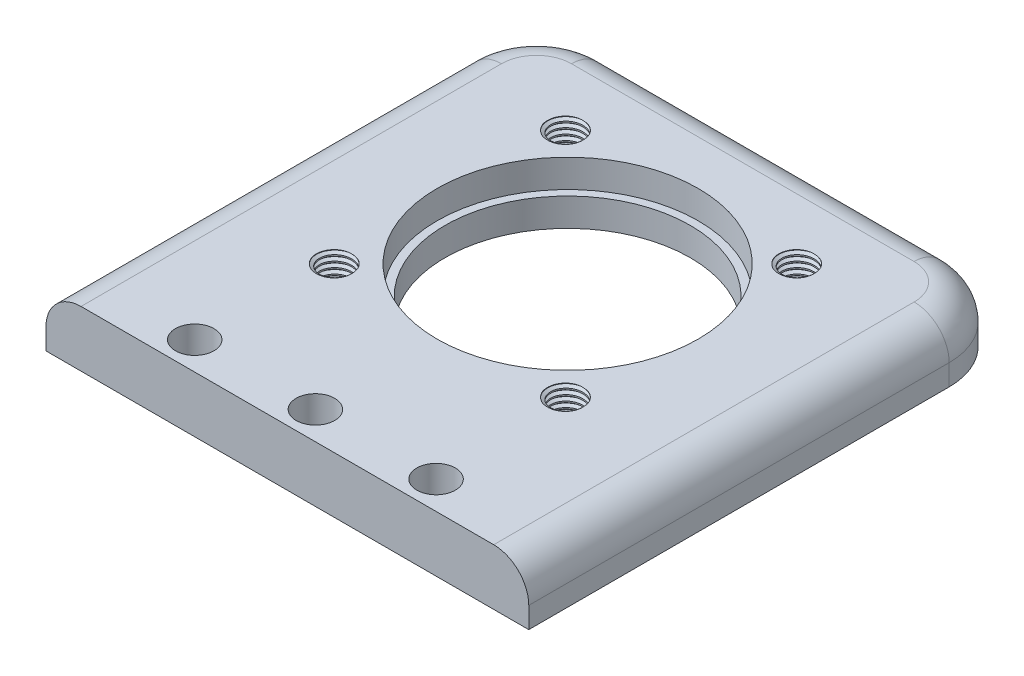
from build123d import *

# Parameters (mm, degrees)
SKETCH1_W           = 68.9
SKETCH1_H           = 70
SKETCH1_R           = 18.63
SKETCH1_R_2         = 2.75
BOSS_EXTRUDE1_DEPTH = 8
FILLET1_R           = 10
FILLET2_R           = 5
SKETCH2_R           = 18.63
SKETCH2_R_2         = 17.5
BOSS_EXTRUDE2_DEPTH = 4
SKETCH5_R           = 2.3
CUT_EXTRUDE1_DEPTH  = 6
THREAD1_PITCH       = 0.8
THREAD2_PITCH       = 0.8
THREAD3_PITCH       = 0.8
CUT_EXTRUDE2_DEPTH  = 6
THREAD4_PITCH       = 0.8


with BuildPart() as part:
    # Sketch1 → Boss-Extrude1 (new body)
    with BuildSketch(Plane(origin=(0, 0, 0), x_dir=(1, 0, 0), z_dir=(0, 1, 0))):
        with Locations((34.45, 35)):
            Rectangle(SKETCH1_W, SKETCH1_H)
        with Locations(Location((34.45, 40, 0), (0, 0, 270))):
            Circle(SKETCH1_R, mode=Mode.SUBTRACT)
        with Locations(Location((34.45, 4, 0), (0, 0, 270))):
            Circle(SKETCH1_R_2, mode=Mode.SUBTRACT)
        with Locations(Location((17.225, 4, 0), (0, 0, 270))):
            Circle(SKETCH1_R_2, mode=Mode.SUBTRACT)
        with Locations(Location((51.675, 4, 0), (0, 0, 270))):
            Circle(SKETCH1_R_2, mode=Mode.SUBTRACT)
    extrude(amount=BOSS_EXTRUDE1_DEPTH)

    # Fillet1
    fillet1_edges = [part.edges().sort_by_distance(p)[0] for p in [
        (0, 4, -70),
        (68.9, 4, -70),
    ]]
    fillet(fillet1_edges, radius=FILLET1_R)

    # Fillet2
    fillet2_edges = [part.edges().sort_by_distance(p)[0] for p in [
        (68.9, 8, -30),
        (34.45, 8, -70),
        (0, 8, -30),
        (2.928932188, 8, -67.071067812),
        (65.971067812, 8, -67.071067812),
    ]]
    fillet(fillet2_edges, radius=FILLET2_R)

    # Sketch2 → Boss-Extrude2 (add)
    with BuildSketch(Plane.XZ):
        with Locations(Location((34.45, -40, 0), (0, 0, 270))):
            Circle(SKETCH2_R)
        with Locations(Location((34.45, -40, 0), (0, 0, 270))):
            Circle(SKETCH2_R_2, mode=Mode.SUBTRACT)
    extrude(amount=-BOSS_EXTRUDE2_DEPTH)

    # Sketch5 → Cut-Extrude1 (cut)
    with BuildSketch(Plane(origin=(0, 8, 0), x_dir=(1, 0, 0), z_dir=(0, 1, 0))):
        with Locations(Location((17.95, 23.5, 0), (0, 0, 270))):
            Circle(SKETCH5_R)
        with Locations(Location((50.95, 23.5, 0), (0, 0, 270))):
            Circle(SKETCH5_R)
        with Locations(Location((17.95, 56.5, 0), (0, 0, 270))):
            Circle(SKETCH5_R)
        with BuildLine():
            Line((50.95, 56.5), (50.95, 54.2))
            ThreePointArc((50.95, 54.2), (52.576345597, 58.126345597), (48.65, 56.5))
            Line((48.65, 56.5), (50.95, 56.5))
        make_face()
    extrude(amount=-CUT_EXTRUDE1_DEPTH, mode=Mode.SUBTRACT)

    # Thread1: the profile of Thread Profile1 profile screwed along a right-hand helix of 8.75 turns, 8 arcs to a turn; built about Z, then put on its axis
    thread1_z = Axis((0, 0, 0), (0, 0, 1))
    thread1_corners = [(2.2997, 0, -0.000173205), (2.7330127, 0, 0.249999999), (2.7330127, 0, 0.349999999), (2.2997, 0, 0.600173203)]
    with BuildLine(mode=Mode.PRIVATE) as thread1_profile:
        Line(thread1_corners[0], thread1_corners[1])
        Line(thread1_corners[1], thread1_corners[2])
        Line(thread1_corners[2], thread1_corners[3])
        Line(thread1_corners[3], thread1_corners[0])
    thread1_cap = Face(thread1_profile.wire())
    thread1_turn_angles = [0, 22.5, 45, 67.5, 90, 112.5, 135, 157.5, 180, 202.5, 225, 247.5, 270, 292.5, 315, 337.5, 360]
    thread1_turn_weights = [1, 0.9238795325112867, 1, 0.9238795325112867, 1, 0.9238795325112867, 1, 0.9238795325112867, 1, 0.9238795325112867, 1, 0.9238795325112867, 1, 0.9238795325112867, 1, 0.9238795325112867, 1]
    thread1_turn_rails = [Edge.make_bspline([Vector(p[0], p[1], 0).rotate(thread1_z, thread1_turn_angles[k]) / thread1_turn_weights[k] + Vector(0, 0, p[2] + THREAD1_PITCH * thread1_turn_angles[k] / 360) for k in range(17)], [0, 0, 0, 1, 1, 2, 2, 3, 3, 4, 4, 5, 5, 6, 6, 7, 7, 8, 8, 8], 2, thread1_turn_weights) for p in thread1_corners]
    thread1_turn_sides = [Face.make_surface_from_curves(thread1_turn_rails[p[0]], thread1_turn_rails[p[1]]) for p in [(0, 1), (1, 2), (2, 3), (3, 0)]]
    thread1_last_angles = [2880, 2902.5, 2925, 2947.5, 2970, 2992.5, 3015, 3037.5, 3060, 3082.5, 3105, 3127.5, 3150]
    thread1_last_weights = [1, 0.9238795325112867, 1, 0.9238795325112867, 1, 0.9238795325112867, 1, 0.9238795325112867, 1, 0.9238795325112867, 1, 0.9238795325112898, 1]
    thread1_last_rails = [Edge.make_bspline([Vector(p[0], p[1], 0).rotate(thread1_z, thread1_last_angles[k]) / thread1_last_weights[k] + Vector(0, 0, p[2] + THREAD1_PITCH * thread1_last_angles[k] / 360) for k in range(13)], [0, 0, 0, 1, 1, 2, 2, 3, 3, 4, 4, 5, 5, 6, 6, 6], 2, thread1_last_weights) for p in thread1_corners]
    thread1_last_sides = [Face.make_surface_from_curves(thread1_last_rails[p[0]], thread1_last_rails[p[1]]) for p in [(0, 1), (1, 2), (2, 3), (3, 0)]]
    thread1 = Plane(origin=(17.95, 9, -56.5), x_dir=(-1, 0, 0), z_dir=(0, -1, 0)) * Solid(Shell([*[p.moved(Location((0, 0, THREAD1_PITCH * i))) for i in range(8) for p in thread1_turn_sides], *thread1_last_sides, thread1_cap, thread1_cap.rotate(thread1_z, 3150).moved(Location((0, 0, THREAD1_PITCH * 3150 / 360)))]))
    add(thread1, mode=Mode.SUBTRACT)

    # Thread2: the profile of Thread Profile2 profile screwed along a right-hand helix of 8.75 turns, 8 arcs to a turn; built about Z, then put on its axis
    thread2_z = Axis((0, 0, 0), (0, 0, 1))
    thread2_corners = [(2.2997, 0, -0.000173205), (2.7330127, 0, 0.249999999), (2.7330127, 0, 0.349999999), (2.2997, 0, 0.600173203)]
    with BuildLine(mode=Mode.PRIVATE) as thread2_profile:
        Line(thread2_corners[0], thread2_corners[1])
        Line(thread2_corners[1], thread2_corners[2])
        Line(thread2_corners[2], thread2_corners[3])
        Line(thread2_corners[3], thread2_corners[0])
    thread2_cap = Face(thread2_profile.wire())
    thread2_turn_angles = [0, 22.5, 45, 67.5, 90, 112.5, 135, 157.5, 180, 202.5, 225, 247.5, 270, 292.5, 315, 337.5, 360]
    thread2_turn_weights = [1, 0.9238795325112867, 1, 0.9238795325112867, 1, 0.9238795325112867, 1, 0.9238795325112867, 1, 0.9238795325112867, 1, 0.9238795325112867, 1, 0.9238795325112867, 1, 0.9238795325112867, 1]
    thread2_turn_rails = [Edge.make_bspline([Vector(p[0], p[1], 0).rotate(thread2_z, thread2_turn_angles[k]) / thread2_turn_weights[k] + Vector(0, 0, p[2] + THREAD2_PITCH * thread2_turn_angles[k] / 360) for k in range(17)], [0, 0, 0, 1, 1, 2, 2, 3, 3, 4, 4, 5, 5, 6, 6, 7, 7, 8, 8, 8], 2, thread2_turn_weights) for p in thread2_corners]
    thread2_turn_sides = [Face.make_surface_from_curves(thread2_turn_rails[p[0]], thread2_turn_rails[p[1]]) for p in [(0, 1), (1, 2), (2, 3), (3, 0)]]
    thread2_last_angles = [2880, 2902.5, 2925, 2947.5, 2970, 2992.5, 3015, 3037.5, 3060, 3082.5, 3105, 3127.5, 3150]
    thread2_last_weights = [1, 0.9238795325112867, 1, 0.9238795325112867, 1, 0.9238795325112867, 1, 0.9238795325112867, 1, 0.9238795325112867, 1, 0.9238795325112898, 1]
    thread2_last_rails = [Edge.make_bspline([Vector(p[0], p[1], 0).rotate(thread2_z, thread2_last_angles[k]) / thread2_last_weights[k] + Vector(0, 0, p[2] + THREAD2_PITCH * thread2_last_angles[k] / 360) for k in range(13)], [0, 0, 0, 1, 1, 2, 2, 3, 3, 4, 4, 5, 5, 6, 6, 6], 2, thread2_last_weights) for p in thread2_corners]
    thread2_last_sides = [Face.make_surface_from_curves(thread2_last_rails[p[0]], thread2_last_rails[p[1]]) for p in [(0, 1), (1, 2), (2, 3), (3, 0)]]
    thread2 = Plane(origin=(50.95, 9, -23.5), x_dir=(-1, 0, 0), z_dir=(0, -1, 0)) * Solid(Shell([*[p.moved(Location((0, 0, THREAD2_PITCH * i))) for i in range(8) for p in thread2_turn_sides], *thread2_last_sides, thread2_cap, thread2_cap.rotate(thread2_z, 3150).moved(Location((0, 0, THREAD2_PITCH * 3150 / 360)))]))
    add(thread2, mode=Mode.SUBTRACT)

    # Thread3: the profile of Thread Profile3 profile screwed along a right-hand helix of 8.75 turns, 8 arcs to a turn; built about Z, then put on its axis
    thread3_z = Axis((0, 0, 0), (0, 0, 1))
    thread3_corners = [(2.2997, 0, -0.000173205), (2.7330127, 0, 0.249999999), (2.7330127, 0, 0.349999999), (2.2997, 0, 0.600173203)]
    with BuildLine(mode=Mode.PRIVATE) as thread3_profile:
        Line(thread3_corners[0], thread3_corners[1])
        Line(thread3_corners[1], thread3_corners[2])
        Line(thread3_corners[2], thread3_corners[3])
        Line(thread3_corners[3], thread3_corners[0])
    thread3_cap = Face(thread3_profile.wire())
    thread3_turn_angles = [0, 22.5, 45, 67.5, 90, 112.5, 135, 157.5, 180, 202.5, 225, 247.5, 270, 292.5, 315, 337.5, 360]
    thread3_turn_weights = [1, 0.9238795325112867, 1, 0.9238795325112867, 1, 0.9238795325112867, 1, 0.9238795325112867, 1, 0.9238795325112867, 1, 0.9238795325112867, 1, 0.9238795325112867, 1, 0.9238795325112867, 1]
    thread3_turn_rails = [Edge.make_bspline([Vector(p[0], p[1], 0).rotate(thread3_z, thread3_turn_angles[k]) / thread3_turn_weights[k] + Vector(0, 0, p[2] + THREAD3_PITCH * thread3_turn_angles[k] / 360) for k in range(17)], [0, 0, 0, 1, 1, 2, 2, 3, 3, 4, 4, 5, 5, 6, 6, 7, 7, 8, 8, 8], 2, thread3_turn_weights) for p in thread3_corners]
    thread3_turn_sides = [Face.make_surface_from_curves(thread3_turn_rails[p[0]], thread3_turn_rails[p[1]]) for p in [(0, 1), (1, 2), (2, 3), (3, 0)]]
    thread3_last_angles = [2880, 2902.5, 2925, 2947.5, 2970, 2992.5, 3015, 3037.5, 3060, 3082.5, 3105, 3127.5, 3150]
    thread3_last_weights = [1, 0.9238795325112867, 1, 0.9238795325112867, 1, 0.9238795325112867, 1, 0.9238795325112867, 1, 0.9238795325112867, 1, 0.9238795325112898, 1]
    thread3_last_rails = [Edge.make_bspline([Vector(p[0], p[1], 0).rotate(thread3_z, thread3_last_angles[k]) / thread3_last_weights[k] + Vector(0, 0, p[2] + THREAD3_PITCH * thread3_last_angles[k] / 360) for k in range(13)], [0, 0, 0, 1, 1, 2, 2, 3, 3, 4, 4, 5, 5, 6, 6, 6], 2, thread3_last_weights) for p in thread3_corners]
    thread3_last_sides = [Face.make_surface_from_curves(thread3_last_rails[p[0]], thread3_last_rails[p[1]]) for p in [(0, 1), (1, 2), (2, 3), (3, 0)]]
    thread3 = Plane(origin=(17.95, 9, -23.5), x_dir=(-1, 0, 0), z_dir=(0, -1, 0)) * Solid(Shell([*[p.moved(Location((0, 0, THREAD3_PITCH * i))) for i in range(8) for p in thread3_turn_sides], *thread3_last_sides, thread3_cap, thread3_cap.rotate(thread3_z, 3150).moved(Location((0, 0, THREAD3_PITCH * 3150 / 360)))]))
    add(thread3, mode=Mode.SUBTRACT)

    # Sketch5<3> → Cut-Extrude2 (cut)
    with BuildSketch(Plane(origin=(0, 8, 0), x_dir=(1, 0, 0), z_dir=(0, 1, 0))):
        with BuildLine():
            ThreePointArc((48.65, 56.5), (49.323654403, 54.873654403), (50.95, 54.2))
            Line((50.95, 54.2), (50.95, 56.5))
            Line((50.95, 56.5), (48.65, 56.5))
        make_face()
        with BuildLine():
            Line((50.95, 56.5), (50.95, 54.2))
            ThreePointArc((50.95, 54.2), (52.576345597, 54.873654403), (53.25, 56.5))
            ThreePointArc((53.25, 56.5), (50.95, 58.8), (48.65, 56.5))
            Line((48.65, 56.5), (50.95, 56.5))
        make_face()
    extrude(amount=-CUT_EXTRUDE2_DEPTH, mode=Mode.SUBTRACT)

    # Thread4: the profile of Thread Profile4 profile screwed along a right-hand helix of 8.75 turns, 8 arcs to a turn; built about Z, then put on its axis
    thread4_z = Axis((0, 0, 0), (0, 0, 1))
    thread4_corners = [(2.2997, 0, -0.000173205), (2.7330127, 0, 0.249999999), (2.7330127, 0, 0.349999999), (2.2997, 0, 0.600173203)]
    with BuildLine(mode=Mode.PRIVATE) as thread4_profile:
        Line(thread4_corners[0], thread4_corners[1])
        Line(thread4_corners[1], thread4_corners[2])
        Line(thread4_corners[2], thread4_corners[3])
        Line(thread4_corners[3], thread4_corners[0])
    thread4_cap = Face(thread4_profile.wire())
    thread4_turn_angles = [0, 22.5, 45, 67.5, 90, 112.5, 135, 157.5, 180, 202.5, 225, 247.5, 270, 292.5, 315, 337.5, 360]
    thread4_turn_weights = [1, 0.9238795325112867, 1, 0.9238795325112867, 1, 0.9238795325112867, 1, 0.9238795325112867, 1, 0.9238795325112867, 1, 0.9238795325112867, 1, 0.9238795325112867, 1, 0.9238795325112867, 1]
    thread4_turn_rails = [Edge.make_bspline([Vector(p[0], p[1], 0).rotate(thread4_z, thread4_turn_angles[k]) / thread4_turn_weights[k] + Vector(0, 0, p[2] + THREAD4_PITCH * thread4_turn_angles[k] / 360) for k in range(17)], [0, 0, 0, 1, 1, 2, 2, 3, 3, 4, 4, 5, 5, 6, 6, 7, 7, 8, 8, 8], 2, thread4_turn_weights) for p in thread4_corners]
    thread4_turn_sides = [Face.make_surface_from_curves(thread4_turn_rails[p[0]], thread4_turn_rails[p[1]]) for p in [(0, 1), (1, 2), (2, 3), (3, 0)]]
    thread4_last_angles = [2880, 2902.5, 2925, 2947.5, 2970, 2992.5, 3015, 3037.5, 3060, 3082.5, 3105, 3127.5, 3150]
    thread4_last_weights = [1, 0.9238795325112867, 1, 0.9238795325112867, 1, 0.9238795325112867, 1, 0.9238795325112867, 1, 0.9238795325112867, 1, 0.9238795325112898, 1]
    thread4_last_rails = [Edge.make_bspline([Vector(p[0], p[1], 0).rotate(thread4_z, thread4_last_angles[k]) / thread4_last_weights[k] + Vector(0, 0, p[2] + THREAD4_PITCH * thread4_last_angles[k] / 360) for k in range(13)], [0, 0, 0, 1, 1, 2, 2, 3, 3, 4, 4, 5, 5, 6, 6, 6], 2, thread4_last_weights) for p in thread4_corners]
    thread4_last_sides = [Face.make_surface_from_curves(thread4_last_rails[p[0]], thread4_last_rails[p[1]]) for p in [(0, 1), (1, 2), (2, 3), (3, 0)]]
    thread4 = Plane(origin=(50.95, 9, -56.5), x_dir=(-1, 0, 0), z_dir=(0, -1, 0)) * Solid(Shell([*[p.moved(Location((0, 0, THREAD4_PITCH * i))) for i in range(8) for p in thread4_turn_sides], *thread4_last_sides, thread4_cap, thread4_cap.rotate(thread4_z, 3150).moved(Location((0, 0, THREAD4_PITCH * 3150 / 360)))]))
    add(thread4, mode=Mode.SUBTRACT)


solid = part.part
